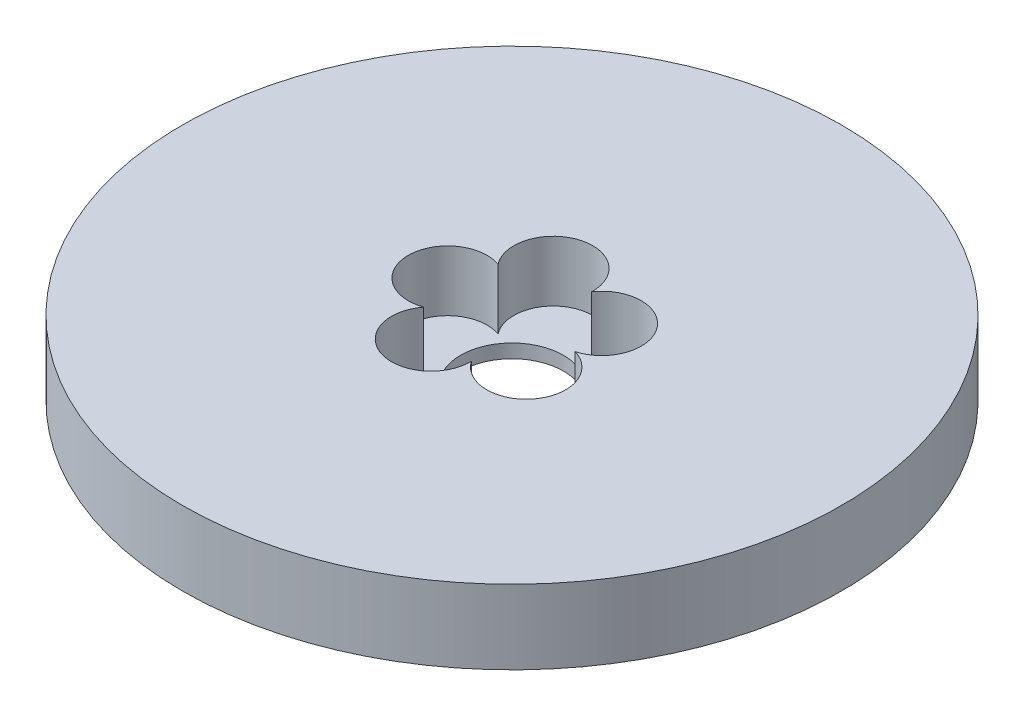
from build123d import *

# Parameters (mm, degrees)
SKETCH1_R           = 80
BOSS_EXTRUDE1_DEPTH = 18
SKETCH2_R           = 12.5
CUT_EXTRUDE1_DEPTH  = 115.560027933
SKETCH3_R           = 9.571617906
CUT_EXTRUDE2_DEPTH  = 14.673865943
CIRPATTERN1_COUNT   = 5


with BuildPart() as part:
    # Sketch1 → Boss-Extrude1 (new body)
    with BuildSketch(Plane(origin=(0, 0, 0), x_dir=(1, 0, 0), z_dir=(0, 1, 0))):
        Circle(SKETCH1_R)
    extrude(amount=BOSS_EXTRUDE1_DEPTH)

    # Sketch2 → Cut-Extrude1 (cut, through all)
    with BuildSketch(Plane(origin=(0, 0, 0), x_dir=(1, 0, 0), z_dir=(0, 1, 0))):
        Circle(SKETCH2_R)
    extrude(amount=CUT_EXTRUDE1_DEPTH, mode=Mode.SUBTRACT)

    # Sketch3 → Cut-Extrude2 (cut)
    with BuildSketch(Plane(origin=(0, 18, 0), x_dir=(1, 0, 0), z_dir=(0, 1, 0))):
        with Locations((-15.612808267, 0)):
            Circle(SKETCH3_R)
    cut_extrude2 = extrude(amount=-CUT_EXTRUDE2_DEPTH, mode=Mode.SUBTRACT)

    # CirPattern1: Cut-Extrude2 ×5 about axis
    cirpattern1_axis = Axis((0, 0, 0), (0, 1, 0))
    for i in range(1, CIRPATTERN1_COUNT):
        add(cut_extrude2.rotate(cirpattern1_axis, i * 360 / CIRPATTERN1_COUNT), mode=Mode.SUBTRACT)


solid = part.part
